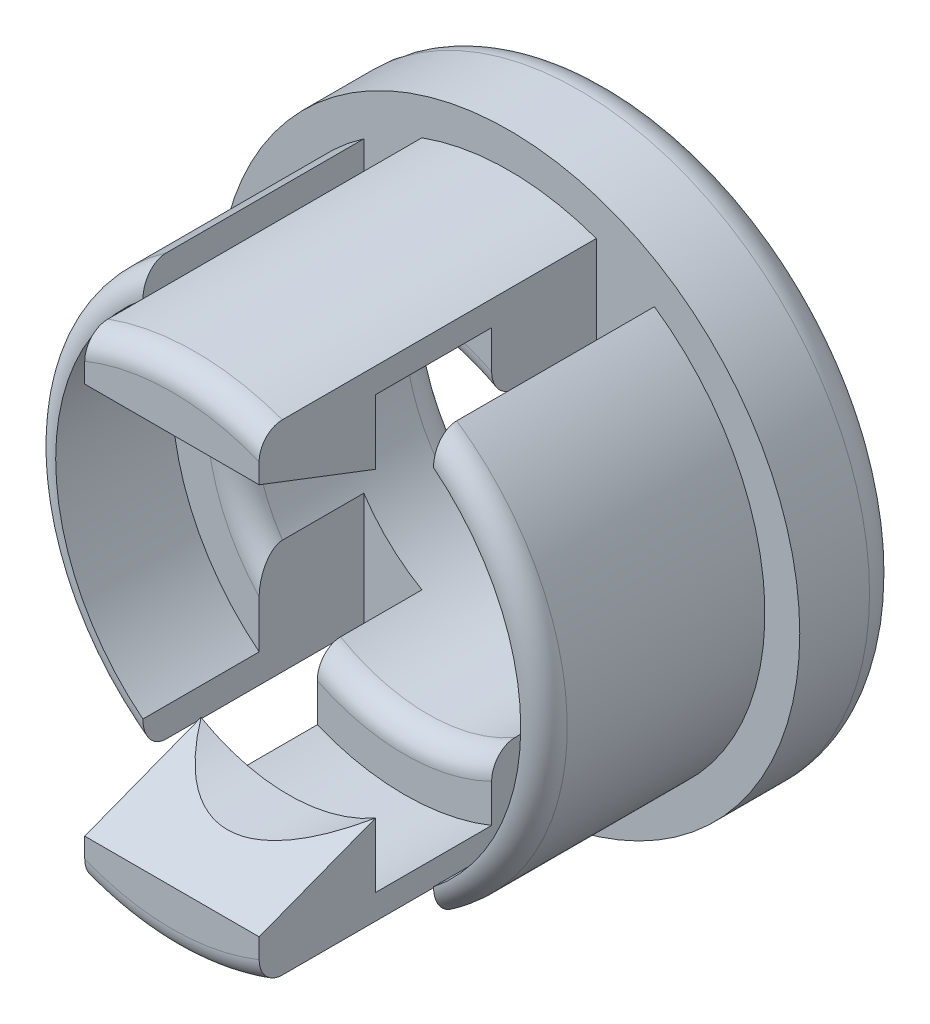
from build123d import *

# Parameters (mm, degrees)
SKETCH_1_R               = 2.5
EXTRUDE_1_DEPTH          = 0.9
SKETCH_2_R               = 2.2
EXTRUDE_2_DEPTH          = 2.9
CUT_EXTRUDE_1_DEPTH      = 6.190375709
CUT_EXTRUDE_1_DEPTH_BACK = 6.190375709
SKETCH_3_R               = 1.5
SKETCH_4_W               = 0.5
SKETCH_4_H               = 8
CUT_EXTRUDE_2_DEPTH      = 2.9
SKETCH_5_W               = 2
SKETCH_5_H               = 6
CUT_EXTRUDE_3_DEPTH      = 1
SKETCH_6_R               = 2
CUT_EXTRUDE_4_DEPTH      = 1
CUT_EXTRUDE_5_DEPTH      = 6.590393546
FILLET_1_R               = 0.3
FILLET_2_R               = 0.2


with BuildPart() as part:
    # Эскиз1 → Бобышка-Вытянуть1 (new body)
    with BuildSketch(Plane.XY):
        Circle(SKETCH_1_R)
    extrude(amount=EXTRUDE_1_DEPTH)

    # Эскиз2 → Бобышка-Вытянуть2 (add)
    with BuildSketch(Plane.XY.offset(0.9)):
        Circle(SKETCH_2_R)
    extrude(amount=EXTRUDE_2_DEPTH)

    # Эскиз3 → Вырез-Вытянуть1 (cut, two sides: drawn at the far end of the back side and taken through both)
    with BuildSketch(Plane.XY.offset(3.8).offset(-CUT_EXTRUDE_1_DEPTH_BACK)):
        Circle(SKETCH_3_R)
    extrude(amount=CUT_EXTRUDE_1_DEPTH + CUT_EXTRUDE_1_DEPTH_BACK, mode=Mode.SUBTRACT)

    # Эскиз4 → Вырез-Вытянуть2 (cut)
    with BuildSketch(Plane.XY.offset(3.8)):
        with Locations((-1, 0)):
            Rectangle(SKETCH_4_W, SKETCH_4_H)
        with Locations((1, 0)):
            Rectangle(SKETCH_4_W, SKETCH_4_H)
    extrude(amount=-CUT_EXTRUDE_2_DEPTH, mode=Mode.SUBTRACT)

    # Эскиз5 → Вырез-Вытянуть3 (cut)
    with BuildSketch(Plane.XY.offset(3.8)):
        with Locations((-2.25, -1.189613301)):
            Rectangle(SKETCH_5_W, SKETCH_5_H)
        with Locations((2.25, -1.189613301)):
            Rectangle(SKETCH_5_W, SKETCH_5_H)
    extrude(amount=-CUT_EXTRUDE_3_DEPTH, mode=Mode.SUBTRACT)

    # Эскиз6 → Вырез-Вытянуть4 (cut)
    with BuildSketch(Plane.XY.offset(2.8)):
        Circle(SKETCH_6_R)
    extrude(amount=-CUT_EXTRUDE_4_DEPTH, mode=Mode.SUBTRACT)

    # Эскиз7 → Вырез-Вытянуть5 (cut, through all)
    with BuildSketch(Plane.ZY.offset(0.75)):
        Polygon((3.8, 1.683624947), (2.8, 1.299038106), (3.8, 1.299038106), align=None)
        Polygon((3.8, -1.683624947), (2.8, -1.299038106), (3.8, -1.299038106), align=None)
    extrude(amount=-CUT_EXTRUDE_5_DEPTH, mode=Mode.SUBTRACT)

    # Скругление1
    fillet_1_edges = [part.edges().sort_by_distance(p)[0] for p in [
        (-1.5, 0, 0),
        (-2.5, 0, 0),
    ]]
    fillet(fillet_1_edges, radius=FILLET_1_R)

    # Скругление2
    fillet_2_edges = [part.edges().sort_by_distance(p)[0] for p in [
        (1.436140662, 0.433012702, 1.8),
        (0, -1.5, 1.8),
        (0, 1.5, 1.8),
        (-1.5, 0, 1.8),
        (0, 2.2, 3.8),
        (0, -2.2, 3.8),
        (2.2, 0, 2.8),
        (-2.2, 0, 2.8),
    ]]
    fillet(fillet_2_edges, radius=FILLET_2_R - 0.0001)  # a hair under: the kernel refuses the full size


solid = part.part
